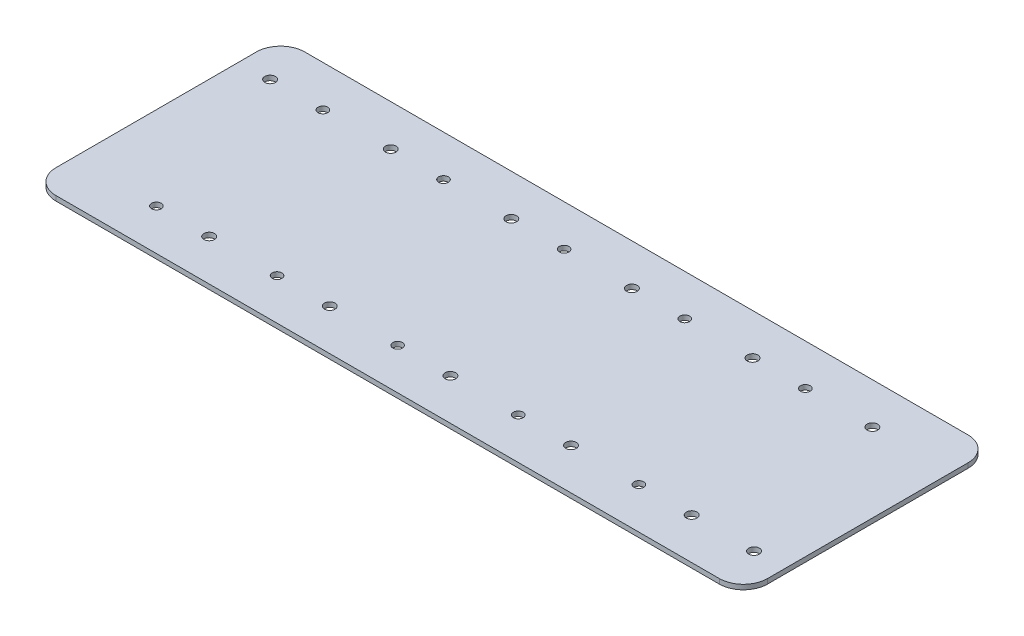
from build123d import *

# Parameters (mm, degrees)
SKETCH1_W               = 236
SKETCH1_H               = 82.5
BOSS_EXTRUDE1_DEPTH     = 1.6
FILLET1_R               = 8
CUT_EXTRUDE1_DEPTH      = 126.012489376
CUT_EXTRUDE1_DEPTH_BACK = 126.012489376
SKETCH2_R               = 1.6
SKETCH2_R_2             = 1.75


with BuildPart() as part:
    # Sketch1 → Boss-Extrude1 (new body)
    with BuildSketch(Plane(origin=(0, 0, 0), x_dir=(1, 0, 0), z_dir=(0, 1, 0))):
        Rectangle(SKETCH1_W, SKETCH1_H)
    extrude(amount=BOSS_EXTRUDE1_DEPTH)

    # Fillet1
    fillet1_edges = [part.edges().sort_by_distance(p)[0] for p in [
        (118, 0.8, -41.25),
        (118, 0.8, 41.25),
        (-118, 0.8, -41.25),
        (-118, 0.8, 41.25),
    ]]
    fillet(fillet1_edges, radius=FILLET1_R)

    # Sketch2 → Cut-Extrude1 (cut, two sides: drawn at the far end of the back side and taken through both)
    with BuildSketch(Plane(origin=(0, 1.6, 0), x_dir=(1, 0, 0), z_dir=(0, 1, 0)).offset(-CUT_EXTRUDE1_DEPTH_BACK)):
        with Locations((-90.3251, 27.6)):
            Circle(SKETCH2_R)
        with Locations((-90.3251, -27.6)):
            Circle(SKETCH2_R)
        with Locations((-72.8251, -27.6)):
            Circle(SKETCH2_R_2)
        with Locations((-107.8251, 27.6)):
            Circle(SKETCH2_R_2)
        with Locations((-67.8251, 27.6)):
            Circle(SKETCH2_R_2)
        with Locations((-50.3251, 27.6)):
            Circle(SKETCH2_R)
        with Locations((-27.8251, 27.6)):
            Circle(SKETCH2_R_2)
        with Locations((-10.3251, 27.6)):
            Circle(SKETCH2_R)
        with Locations((12.1749, 27.6)):
            Circle(SKETCH2_R_2)
        with Locations((29.6749, 27.6)):
            Circle(SKETCH2_R)
        with Locations((52.1749, 27.6)):
            Circle(SKETCH2_R_2)
        with Locations((-50.3251, -27.6)):
            Circle(SKETCH2_R)
        with Locations((-32.8251, -27.6)):
            Circle(SKETCH2_R_2)
        with Locations((-10.3251, -27.6)):
            Circle(SKETCH2_R)
        with Locations((7.1749, -27.6)):
            Circle(SKETCH2_R_2)
        with Locations((29.6749, -27.6)):
            Circle(SKETCH2_R)
        with Locations((47.1749, -27.6)):
            Circle(SKETCH2_R_2)
        with Locations((69.6749, -27.6)):
            Circle(SKETCH2_R)
        with Locations((87.1749, -27.6)):
            Circle(SKETCH2_R_2)
        with Locations((69.6749, 27.6)):
            Circle(SKETCH2_R)
        with Locations((91.889, 27.625448388)):
            Circle(SKETCH2_R_2)
        with Locations((107.891, -27.619551612)):
            Circle(SKETCH2_R_2)
    extrude(amount=CUT_EXTRUDE1_DEPTH + CUT_EXTRUDE1_DEPTH_BACK, mode=Mode.SUBTRACT)


solid = part.part
